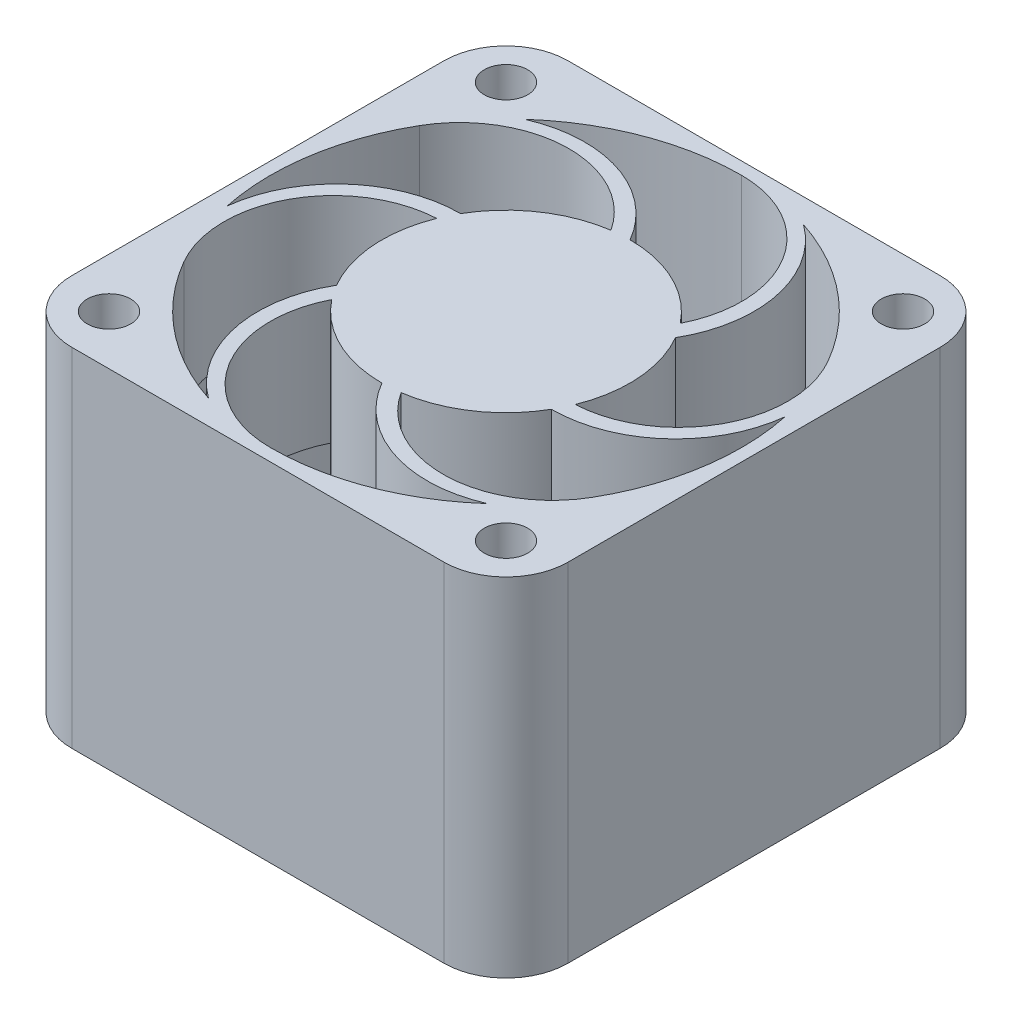
from build123d import *

# Parameters (mm, degrees)
EXTRUDE_1_DEPTH          = 28
SKETCH_2_R               = 1.75
CUT_EXTRUDE_1_DEPTH      = 40.799497484
SKETCH_3_R               = 19
SKETCH_3_R_2             = 10
CUT_EXTRUDE_2_DEPTH      = 40.799497484
EXTRUDE_2_DEPTH          = 10
PATTERN_START            = 18
PATTERN_CIRCULAR_1_DEPTH = 10


# Read off the part's stored shape, not the designer's step: 阵列(圆周)1
with BuildPart() as part:
    # 草图1 → 凸台-拉伸1 (new body)
    with BuildSketch(Plane(origin=(0, 0, 0), x_dir=(1, 0, 0), z_dir=(0, 1, 0))):
        with BuildLine():
            Line((-15, 20), (15, 20))
            ThreePointArc((15, 20), (18.535533906, 18.535533906), (20, 15))
            Line((20, 15), (20, -15))
            ThreePointArc((20, -15), (18.535533906, -18.535533906), (15, -20))
            Line((15, -20), (-15, -20))
            ThreePointArc((-15, -20), (-18.535533906, -18.535533906), (-20, -15))
            Line((-20, -15), (-20, 15))
            ThreePointArc((-20, 15), (-18.535533906, 18.535533906), (-15, 20))
        make_face()
    extrude(amount=EXTRUDE_1_DEPTH)

    # 草图2 → 切除-拉伸1 (cut, through all)
    with BuildSketch(Plane(origin=(0, 28, 0), x_dir=(1, 0, 0), z_dir=(0, 1, 0))):
        with Locations(Location((-16, 16, 0), (0, 0, 270))):
            Circle(SKETCH_2_R)
        with Locations(Location((16, 16, 0), (0, 0, 270))):
            Circle(SKETCH_2_R)
        with Locations(Location((16, -16, 0), (0, 0, 270))):
            Circle(SKETCH_2_R)
        with Locations(Location((-16, -16, 0), (0, 0, 270))):
            Circle(SKETCH_2_R)
    extrude(amount=-CUT_EXTRUDE_1_DEPTH, mode=Mode.SUBTRACT)

    # 草图3 → 切除-拉伸2 (cut, through all)
    with BuildSketch(Plane(origin=(0, 28, 0), x_dir=(1, 0, 0), z_dir=(0, 1, 0))):
        with Locations(Location((0, 0, 0), (0, 0, 270))):
            Circle(SKETCH_3_R)
        with Locations(Location((0, 0, 0), (0, 0, 270))):
            Circle(SKETCH_3_R_2, mode=Mode.SUBTRACT)
    extrude(amount=-CUT_EXTRUDE_2_DEPTH, mode=Mode.SUBTRACT)


with BuildPart() as cut_extrude_2_piece_1:
    # of the separate pieces the step leaves, piece 1, a body of its own (cut_extrude_2_pieces)
    add(part.part.solids().sort_by_distance((-15, 0, -20))[0])



with BuildPart() as cut_extrude_2_piece_2:
    # of the separate pieces the step leaves, piece 2, a body of its own (cut_extrude_2_pieces)
    add(part.part.solids().sort_by_distance((0, 0, 10))[0])


with BuildPart() as cut_extrude_2_piece_1_1:
    add(cut_extrude_2_piece_1.part)

    add(cut_extrude_2_piece_2.part)  # 凸台-拉伸2 merges 切除-拉伸2 piece 2
    # 草图4 → 凸台-拉伸2 (add)
    with BuildSketch(Plane(origin=(0, 28, 0), x_dir=(1, 0, 0), z_dir=(0, 1, 0))):
        with BuildLine():
            Line((0, 20), (0, 19))
            ThreePointArc((0, 19), (8.809946394, 10.190053606), (0, 1.380107213))
            Line((0, 1.380107213), (0, 0))
            ThreePointArc((0, 0), (10, 10), (0, 20))
        make_face()
    extrude(amount=-EXTRUDE_2_DEPTH)

    # 阵列(圆周)1 outline → 阵列(圆周)1 (add)
    with BuildSketch(Plane(origin=(0, 0, 0), x_dir=(1, 0, 0), z_dir=(0, 1, 0)).offset(PATTERN_START)):
        with BuildLine():
            ThreePointArc((-1.43801989, 9.896064814), (-0.720885519, 9.973982358), (0, 10))
            ThreePointArc((0, 10), (-5.537755039, 14.5), (-12.665384489, 14.162910568))
            ThreePointArc((-12.665384489, 14.162910568), (-14.745417919, 11.982180536), (-16.454482672, 9.5))
            ThreePointArc((-16.454482672, 9.5), (-9.057130134, 13.90191043), (-1.43801989, 9.896064814))
        make_face()
        with BuildLine():
            ThreePointArc((18.598132588, 3.887089432), (17.749581696, 6.778816239), (16.454482672, 9.5))
            ThreePointArc((16.454482672, 9.5), (16.56797266, 0.892749566), (9.289253471, -3.702670651))
            ThreePointArc((9.289253471, -3.702670651), (8.998164858, -4.362686006), (8.660254038, -5))
            ThreePointArc((8.660254038, -5), (15.326245874, -2.454163457), (18.598132588, 3.887089432))
        make_face()
        with BuildLine():
            ThreePointArc((-9.289253471, 3.702670651), (-8.998164858, 4.362686006), (-8.660254038, 5))
            ThreePointArc((-8.660254038, 5), (-15.326245874, 2.454163457), (-18.598132588, -3.887089432))
            ThreePointArc((-18.598132588, -3.887089432), (-17.749581696, -6.778816239), (-16.454482672, -9.5))
            ThreePointArc((-16.454482672, -9.5), (-16.56797266, -0.892749566), (-9.289253471, 3.702670651))
        make_face()
        with BuildLine():
            ThreePointArc((16.454482672, -9.5), (9.057130134, -13.90191043), (1.43801989, -9.896064814))
            ThreePointArc((1.43801989, -9.896064814), (0.720885519, -9.973982358), (0, -10))
            ThreePointArc((0, -10), (5.537755039, -14.5), (12.665384489, -14.162910568))
            ThreePointArc((12.665384489, -14.162910568), (14.745417919, -11.982180536), (16.454482672, -9.5))
        make_face()
        with BuildLine():
            ThreePointArc((-7.851233581, -6.193394163), (-8.277279339, -5.611296352), (-8.660254038, -5))
            ThreePointArc((-8.660254038, -5), (-9.788490836, -12.045836544), (-5.932748098, -18.05))
            ThreePointArc((-5.932748098, -18.05), (-3.004163777, -18.760996775), (0, -19))
            ThreePointArc((0, -19), (-7.510842526, -14.794659996), (-7.851233581, -6.193394163))
        make_face()
    extrude(amount=PATTERN_CIRCULAR_1_DEPTH)


solid = cut_extrude_2_piece_1_1.part
